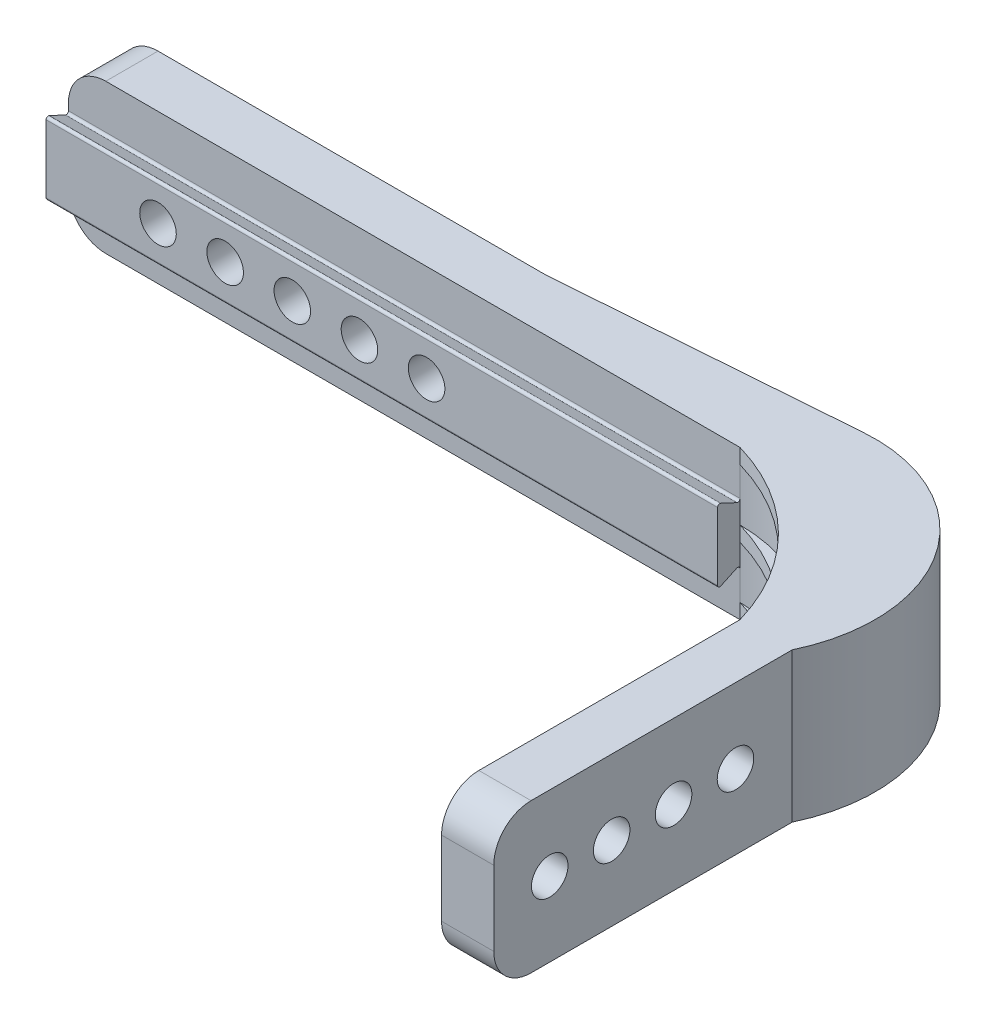
from build123d import *

# Parameters (mm, degrees)
BOSS_EXTRUDE1_DEPTH = 20
BOSS_EXTRUDE2_DEPTH = 90
SKETCH4_R           = 2.45
CUT_EXTRUDE1_DEPTH  = 137.301137193
LPATTERN1_COUNT     = 4
LPATTERN1_PITCH     = 8.3
SKETCH5_R           = 2.45
CUT_EXTRUDE2_DEPTH  = 14
LPATTERN2_COUNT     = 5
LPATTERN2_PITCH     = 9
FILLET2_R           = 5
BOSS_EXTRUDE4_DEPTH = 20
BOSS_EXTRUDE5_DEPTH = 2
LPATTERN3_COUNT     = 3
LPATTERN3_PITCH     = 9
FILLET3_R           = 0.3
FILLET4_R           = 20


with BuildPart() as part:
    # Sketch1 → Boss-Extrude1 (new body)
    with BuildSketch(Plane(origin=(0, 0, 0), x_dir=(1, 0, 0), z_dir=(0, 1, 0))):
        with BuildLine():
            Line((0, 0), (90, 0))
            ThreePointArc((90, 0), (109.091883092, -7.908116908), (117, -27))
            Line((117, -27), (117, -67))
            Line((117, -67), (110, -67))
            Line((110, -67), (110, -27))
            ThreePointArc((110, -27), (104.142135624, -12.857864376), (90, -7))
            Line((90, -7), (0, -7))
            Line((0, -7), (0, 0))
        make_face()
    extrude(amount=BOSS_EXTRUDE1_DEPTH)

    # Sketch2 → Boss-Extrude2 (add)
    with BuildSketch(Plane(origin=(0, 0, 0), x_dir=(0, 0, -1), z_dir=(1, 0, 0))):
        Polygon((-10, 15), (-10, 5), (-7, 6.398922974), (-7, 13.601077026), align=None)
    extrude(amount=BOSS_EXTRUDE2_DEPTH)

    # Sketch4 → Cut-Extrude1 (cut, through all)
    with BuildSketch(Plane(origin=(0, 0, 0), x_dir=(0, 0, -1), z_dir=(1, 0, 0))):
        with Locations(Location((-59.5, 10, 0), (0, 0, 180))):
            Circle(SKETCH4_R)
    cut_extrude1 = extrude(amount=CUT_EXTRUDE1_DEPTH, mode=Mode.SUBTRACT)

    # LPattern1: Cut-Extrude1 ×4
    with Locations(*[(0, 0, -i * LPATTERN1_PITCH) for i in range(1, LPATTERN1_COUNT)]):
        add(cut_extrude1, mode=Mode.SUBTRACT)

    # Sketch5 → Cut-Extrude2 (cut)
    with BuildSketch(Plane.XY):
        with Locations(Location((15, 10, 0), (0, 0, 90))):
            Circle(SKETCH5_R)
    cut_extrude2 = extrude(amount=CUT_EXTRUDE2_DEPTH, mode=Mode.SUBTRACT)

    # LPattern2: Cut-Extrude2 ×5
    with Locations(*[(i * LPATTERN2_PITCH, 0, 0) for i in range(1, LPATTERN2_COUNT)]):
        add(cut_extrude2, mode=Mode.SUBTRACT)

    # Fillet2
    fillet2_edges = [part.edges().sort_by_distance(p)[0] for p in [
        (0, 0, 3.5),
        (113.5, 20, 67),
        (0, 20, 3.5),
        (113.5, 0, 67),
    ]]
    fillet(fillet2_edges, radius=FILLET2_R)

    # Sketch6 → Boss-Extrude4 (add)
    with BuildSketch(Plane(origin=(0, 0, 0), x_dir=(1, 0, 0), z_dir=(0, 1, 0))):
        with BuildLine():
            Line((57.067989457, 0), (96.460545107, 3))
            ThreePointArc((96.460545107, 3), (115.383129249, -6.075834674), (117, -27))
            ThreePointArc((117, -27), (109.091883092, -7.908116908), (90, 0))
            Line((90, 0), (57.067989457, 0))
        make_face()
    extrude(amount=BOSS_EXTRUDE4_DEPTH)

    # Sketch8 → Boss-Extrude5 (add)
    with BuildSketch(Plane(origin=(0, 0, 0), x_dir=(1, 0, 0), z_dir=(0, 1, 0))):
        with BuildLine():
            ThreePointArc((90, -7), (102.578584062, -14.421415938), (110, -27))
            ThreePointArc((110, -27), (104.142135624, -12.857864376), (90, -7))
        make_face()
    boss_extrude5 = extrude(amount=BOSS_EXTRUDE5_DEPTH)

    # LPattern3: Boss-Extrude5 ×3
    with Locations(*[(0, i * LPATTERN3_PITCH, 0) for i in range(1, LPATTERN3_COUNT)]):
        add(boss_extrude5)

    # Fillet3
    fillet3_edges = [part.edges().sort_by_distance(p)[0] for p in [
        (45, 13.601077026, 7),
        (45, 15, 10),
        (45, 5, 10),
        (45, 6.398922974, 7),
    ]]
    fillet(fillet3_edges, radius=FILLET3_R)

    # Fillet4
    # the kernel refuses this fillet: 20 mm, written as the material it adds along each edge
    with BuildSketch(Plane(origin=(57.067989457, 0, 0), x_dir=(0.9971126456779296, 0, -0.07593663035162816), z_dir=(0, 1, 0))) as fillet4_piece_1:
        with BuildLine():
            CenterArc((FILLET4_R * 0.0380232084134, FILLET4_R), FILLET4_R, 265.644959248, 4.355040752)
            Line((-FILLET4_R * 0.0379134219382, FILLET4_R * 0.00288735432207), (0, 0))
            Line((0, 0), (FILLET4_R * 0.0380232084134, 0))
        make_face()
    extrude(amount=20)


solid = part.part
